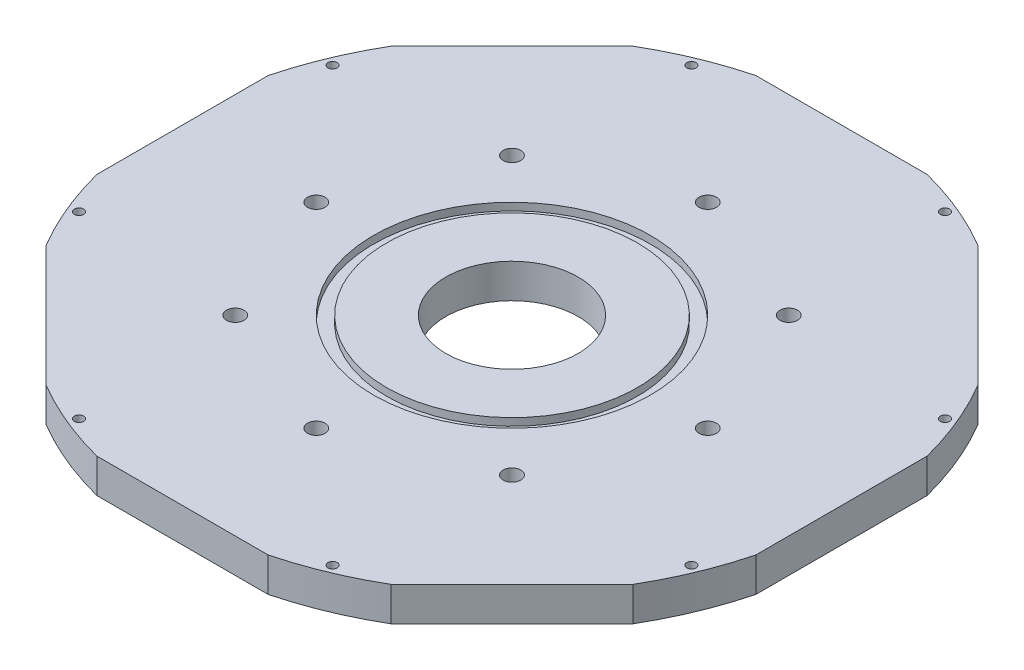
from build123d import *

# Parameters (mm, degrees)
BOSS_EXTRUDE1_DEPTH   = 12.7
SKETCH3_R             = 24.5745
CUT_EXTRUDE1_DEPTH    = 174.423960282
SKETCH5_R             = 51.3715
SKETCH5_R_2           = 46.5455
CUT_EXTRUDE2_DEPTH    = 2.794
SKETCH37_R            = 119.0625
SKETCH37_R_2          = 115.2525
CUT_EXTRUDE7_DEPTH    = 2.667
CIRPATTERN4_COUNT     = 8
F_8_32_TAPPED_HOLE1_D = 3.4544
CIRPATTERN5_COUNT     = 8


with BuildPart() as part:
    # Sketch1 → Boss-Extrude1 (new body)
    with BuildSketch(Plane(origin=(0, 0, 0), x_dir=(1, 0, 0), z_dir=(0, 1, 0))):
        with BuildLine():
            ThreePointArc((-31.793446259, 122.3), (-48.357791931, 116.746037126), (-63.997797892, 108.960520786))
            Line((-63.997797892, 108.960520786), (-108.960520786, 63.997797892))
            ThreePointArc((-108.960520786, 63.997797892), (-116.746037126, 48.357791931), (-122.3, 31.793446259))
            Line((-122.3, 31.793446259), (-122.3, -31.793446259))
            ThreePointArc((-122.3, -31.793446259), (-116.746037126, -48.357791931), (-108.960520786, -63.997797892))
            Line((-108.960520786, -63.997797892), (-63.997797892, -108.960520786))
            ThreePointArc((-63.997797892, -108.960520786), (-48.357791931, -116.746037126), (-31.793446259, -122.3))
            Line((-31.793446259, -122.3), (31.793446259, -122.3))
            ThreePointArc((31.793446259, -122.3), (48.357791931, -116.746037126), (63.997797892, -108.960520786))
            Line((63.997797892, -108.960520786), (108.960520786, -63.997797892))
            ThreePointArc((108.960520786, -63.997797892), (116.746037126, -48.357791931), (122.3, -31.793446259))
            Line((122.3, -31.793446259), (122.3, 31.793446259))
            ThreePointArc((122.3, 31.793446259), (116.746037126, 48.357791931), (108.960520786, 63.997797892))
            Line((108.960520786, 63.997797892), (63.997797892, 108.960520786))
            ThreePointArc((63.997797892, 108.960520786), (48.357791931, 116.746037126), (31.793446259, 122.3))
            Line((31.793446259, 122.3), (-31.793446259, 122.3))
        make_face()
    extrude(amount=BOSS_EXTRUDE1_DEPTH)

    # Sketch3 → Cut-Extrude1 (cut, through all)
    with BuildSketch(Plane(origin=(0, 12.7, 0), x_dir=(1, 0, 0), z_dir=(0, 1, 0))):
        Circle(SKETCH3_R)
    extrude(amount=-CUT_EXTRUDE1_DEPTH, mode=Mode.SUBTRACT)

    # Sketch5 → Cut-Extrude2 (cut)
    with BuildSketch(Plane(origin=(0, 12.7, 0), x_dir=(1, 0, 0), z_dir=(0, 1, 0))):
        Circle(SKETCH5_R)
        Circle(SKETCH5_R_2, mode=Mode.SUBTRACT)
    extrude(amount=-CUT_EXTRUDE2_DEPTH, mode=Mode.SUBTRACT)

    # Sketch23 → 5/16-18 Tapped Hole1 (revolve, cut)
    with BuildSketch(Plane(origin=(-72.644, 12.7, 0), x_dir=(0, 0, 1), z_dir=(1, 0, 0))):
        Polygon((0, 0), (0, 8.311148974), (3.2639, 6.35), (3.2639, 0), align=None)
    f_5_16_18_tapped_hole1 = revolve(axis=Axis((-72.644, 19.05, 0), (0, -1, 0)), mode=Mode.SUBTRACT)

    # Sketch37 → Cut-Extrude7 (cut)
    with BuildSketch(Plane.XZ):
        Circle(SKETCH37_R)
        Circle(SKETCH37_R_2, mode=Mode.SUBTRACT)
    extrude(amount=-CUT_EXTRUDE7_DEPTH, mode=Mode.SUBTRACT)

    # CirPattern4: 5/16-18 Tapped Hole1 ×8 about axis
    cirpattern4_axis = Axis((0, 0, 0), (0, 1, 0))
    for i in range(1, CIRPATTERN4_COUNT):
        add(f_5_16_18_tapped_hole1.rotate(cirpattern4_axis, i * 360 / CIRPATTERN4_COUNT), mode=Mode.SUBTRACT)

    # #8-32 Tapped Hole1 (through all)
    with Locations(Plane(origin=(0, 12.7, 0), x_dir=(1, 0, 0), z_dir=(0, 1, 0))):
        with Locations((-47.069870839, 113.636720559)):
            f_8_32_tapped_hole1 = Hole(F_8_32_TAPPED_HOLE1_D / 2)

    # CirPattern5: #8-32 Tapped Hole1 ×8 about axis
    cirpattern5_axis = Axis((0, 0, 0), (0, 1, 0))
    for i in range(1, CIRPATTERN5_COUNT):
        add(f_8_32_tapped_hole1.rotate(cirpattern5_axis, i * 360 / CIRPATTERN5_COUNT), mode=Mode.SUBTRACT)


solid = part.part
